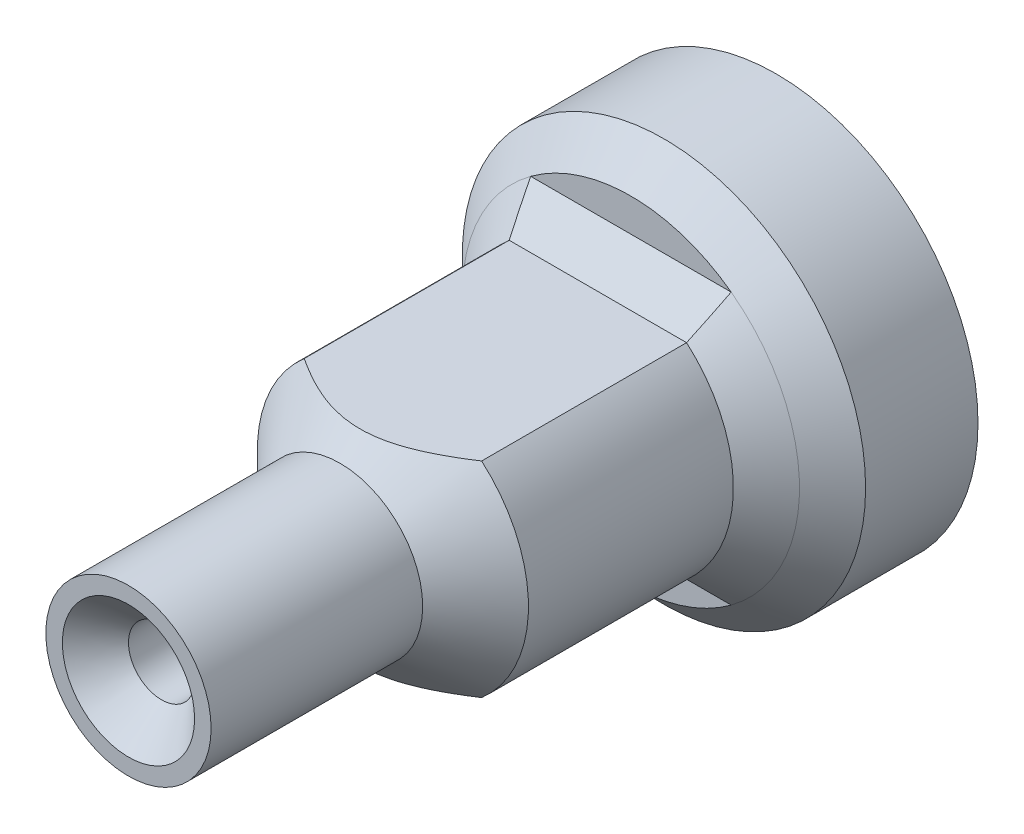
from build123d import *
from build123d.topology import SkipClean

# Parameters (mm, degrees)
ESQUISSE1_R        = 6.1
ESQUISSE1_R_2      = 4.6
BOSS_EXTRU_1_DEPTH = 1.7
ESQUISSE2_R        = 6.1
ESQUISSE2_R_2      = 2.6
BOSS_EXTRU_2_DEPTH = 2.7
BOSS_EXTRU_3_DEPTH = 6.2
BOSS_EXTRU_4_DEPTH = 1
CHANFREIN1_SIZE    = 1
CHANFREIN2_SIZE    = 1
ESQUISSE5_R        = 2.5
ESQUISSE5_R_2      = 1
BOSS_EXTRU_5_DEPTH = 8
CHANFREIN3_SIZE    = 1
CHANFREIN4_SIZE    = 1.6


# Some blends are built 0.0001 mm under size
with BuildPart() as part:
    # Esquisse1 → Boss.-Extru.1 (new body)
    with BuildSketch(Plane.XY):
        Circle(ESQUISSE1_R)
        Circle(ESQUISSE1_R_2, mode=Mode.SUBTRACT)
    extrude(amount=BOSS_EXTRU_1_DEPTH)

    # Esquisse2 → Boss.-Extru.2 (add)
    with BuildSketch(Plane.XY.offset(1.7)):
        Circle(ESQUISSE2_R)
        with Locations(Location((0, 0, 0), (0, 0, 180))):
            Circle(ESQUISSE2_R_2, mode=Mode.SUBTRACT)
    extrude(amount=BOSS_EXTRU_2_DEPTH)

    # Esquisse3 → Boss.-Extru.3 (add)
    with SkipClean():  # the faces are left unmerged after this step: merging them gives an invalid solid
        with BuildSketch(Plane.XY.offset(4.4)):
            with BuildLine():
                Line((2.683282, 3.1), (-2.683282, 3.1))
                ThreePointArc((-2.683282, 3.1), (-4.1, 0), (-2.683282, -3.1))
                Line((-2.683282, -3.1), (2.683282, -3.1))
                ThreePointArc((2.683282, -3.1), (4.1, 0), (2.683282, 3.1))
            make_face()
            with BuildLine():
                Line((2.04939, -1.6), (-2.04939, -1.6))
                ThreePointArc((-2.04939, -1.6), (-2.6, 0), (-2.04939, 1.6))
                Line((-2.04939, 1.6), (2.04939, 1.6))
                ThreePointArc((2.04939, 1.6), (2.6, 0), (2.04939, -1.6))
            make_face(mode=Mode.SUBTRACT)
        extrude(amount=BOSS_EXTRU_3_DEPTH)

    # Esquisse4 → Boss.-Extru.4 (add)
    with SkipClean():  # the faces are left unmerged after this step: merging them gives an invalid solid
        with BuildSketch(Plane.XY.offset(10.6)):
            with BuildLine():
                Line((2.683282, 3.1), (-2.683282, 3.1))
                ThreePointArc((-2.683282, 3.1), (-4.1, 0), (-2.683282, -3.1))
                Line((-2.683282, -3.1), (2.683282, -3.1))
                ThreePointArc((2.683282, -3.1), (4.1, 0), (2.683282, 3.1))
            make_face()
        extrude(amount=BOSS_EXTRU_4_DEPTH)

    # Chanfrein1
    chanfrein1_edges = [part.edges().sort_by_distance(p)[0] for p in [
        (0, 3.1, 4.4),
        (-4.1, 0, 4.4),
        (0, -3.1, 4.4),
        (4.1, 0, 4.4),
        (-6.1, 0, 4.4),
    ]]
    chamfer(chanfrein1_edges, length=CHANFREIN1_SIZE - 0.0001)  # a hair under: the kernel refuses the full size

    # Chanfrein2
    # the kernel refuses this chamfer: 1 mm, written as the material it takes off along each edge
    with BuildSketch(Plane(origin=(4.621073, -1.6, 4.4), x_dir=(0, -0.9996219169112968, -0.027495876610586487), z_dir=(-1, 0, 0))) as chanfrein2_piece_1_section:
        Polygon((CHANFREIN2_SIZE * 0.999621916911, CHANFREIN2_SIZE * 0.0274958766106), (-CHANFREIN2_SIZE * 0.0274958766106, CHANFREIN2_SIZE * 0.999621916911), (0, 0), align=None)
    chanfrein2_piece_1 = extrude(amount=9.242146, mode=Mode.PRIVATE)
    chanfrein2_piece_1 = chanfrein2_piece_1 & Plane(origin=(0, 0, 4.756384), x_dir=(-1, 0, 0), z_dir=(0, 0, -1)) * Cylinder(2.6, 23, mode=Mode.PRIVATE)
    add(chanfrein2_piece_1, mode=Mode.SUBTRACT)
    with BuildSketch(Plane(origin=(-4.621073, 1.6, 4.4), x_dir=(0, 0.9996219169112968, -0.027495876610586487), z_dir=(1, 0, 0))) as chanfrein2_piece_2_section:
        Polygon((CHANFREIN2_SIZE * 0.999621916911, CHANFREIN2_SIZE * 0.0274958766106), (-CHANFREIN2_SIZE * 0.0274958766106, CHANFREIN2_SIZE * 0.999621916911), (0, 0), align=None)
    chanfrein2_piece_2 = extrude(amount=9.242146, mode=Mode.PRIVATE)
    chanfrein2_piece_2 = chanfrein2_piece_2 & Plane(origin=(0, 0, 4.756384), x_dir=(-1, 0, 0), z_dir=(0, 0, -1)) * Cylinder(2.6, 23, mode=Mode.PRIVATE)
    add(chanfrein2_piece_2, mode=Mode.SUBTRACT)

    # Esquisse5 → Boss.-Extru.5 (add)
    with BuildSketch(Plane.XY.offset(11.6)):
        Circle(ESQUISSE5_R)
        Circle(ESQUISSE5_R_2, mode=Mode.SUBTRACT)
    extrude(amount=BOSS_EXTRU_5_DEPTH)

    # Chanfrein3
    chanfrein3_edges = [part.edges().sort_by_distance(p)[0] for p in [
        (-1, 0, 19.6),
    ]]
    chamfer(chanfrein3_edges, length=CHANFREIN3_SIZE)

    # Chanfrein4
    # the kernel refuses this chamfer: 1.6 mm, written as the material it adds along each edge
    with BuildSketch(Plane(origin=(0, 0, 11.6), x_dir=(1, 0, 0), z_dir=(0, -1, 0))) as chanfrein4_piece_1_section:
        Polygon((2.5, CHANFREIN4_SIZE), (2.5 + CHANFREIN4_SIZE, 0), (2.5, 0), align=None)
    chanfrein4_piece_1 = revolve(axis=Axis((0, 0, 11.6), (0, 0, 1)), mode=Mode.PRIVATE)
    chanfrein4_piece_1 = split(chanfrein4_piece_1, bisect_by=Plane(origin=(-3.280327, 3.1, 12.380327), z_dir=(0, -1, 0)), keep=Keep.TOP, mode=Mode.PRIVATE)
    chanfrein4_piece_1 = split(chanfrein4_piece_1, bisect_by=Plane(origin=(-3.280327, -3.1, 12.380327), z_dir=(0, 1, 0)), keep=Keep.TOP, mode=Mode.PRIVATE)
    add(chanfrein4_piece_1)


solid = part.part
